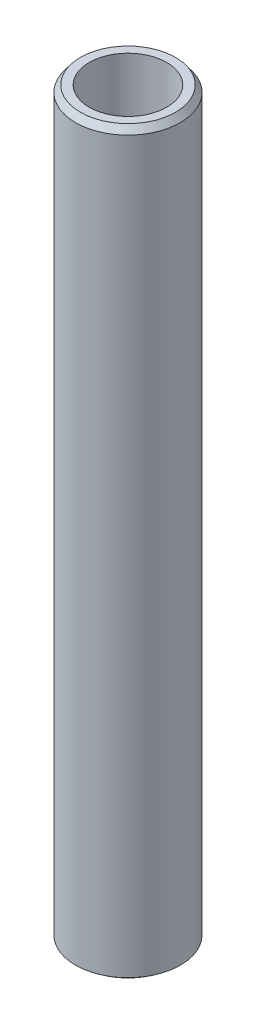
from build123d import *
from OCP.BRepFilletAPI import BRepFilletAPI_MakeChamfer

# Parameters (mm, degrees)
SKETCH1_R           = 15
BOSS_EXTRUDE1_DEPTH = 212.051565752
SKETCH2_R           = 11.097342257
CUT_EXTRUDE1_DEPTH  = 214.10998695
CHAMFER1_SIZE       = 1.872659861
CHAMFER1_SIZE2      = 1.392792281


with BuildPart() as part:
    # Sketch1 → Boss-Extrude1 (new body)
    with BuildSketch(Plane(origin=(0, 0, 0), x_dir=(1, 0, 0), z_dir=(0, 1, 0))):
        Circle(SKETCH1_R)
    extrude(amount=BOSS_EXTRUDE1_DEPTH)

    # Sketch2 → Cut-Extrude1 (cut, through all)
    with BuildSketch(Plane(origin=(0, 0, 0), x_dir=(1, 0, 0), z_dir=(0, 1, 0))):
        Circle(SKETCH2_R)
    extrude(amount=CUT_EXTRUDE1_DEPTH, mode=Mode.SUBTRACT)

    # Chamfer1: one chamfer whose edges measure the first distance from different faces: ONE call of the kernel's chamfer builder (chamfer() names one face for all edges)
    chamfer1_edges_1 = [part.edges().sort_by_distance(p)[0] for p in [
        (-15, 212.051565752, 0),
    ]]
    chamfer1_side_1 = [part.faces().sort_by_distance(p)[0] for p in [
        (-15, 106.025782876, 0),
    ]]
    chamfer1_edges_2 = [part.edges().sort_by_distance(p)[0] for p in [
        (-15, 0, 0),
    ]]
    chamfer1_side_2 = [part.faces().sort_by_distance(p)[0] for p in [
        (-14.575735931, 0, 0),
    ]]
    chamfer1 = BRepFilletAPI_MakeChamfer(part.part.solid().wrapped)
    for e in chamfer1_edges_1:
        chamfer1.Add(CHAMFER1_SIZE, CHAMFER1_SIZE2, e.wrapped, chamfer1_side_1[0].wrapped)  # the first distance lies on this face
    for e in chamfer1_edges_2:
        chamfer1.Add(CHAMFER1_SIZE, CHAMFER1_SIZE2, e.wrapped, chamfer1_side_2[0].wrapped)  # the first distance lies on this face
    add(Compound.cast(chamfer1.Shape()), mode=Mode.REPLACE)


solid = part.part
